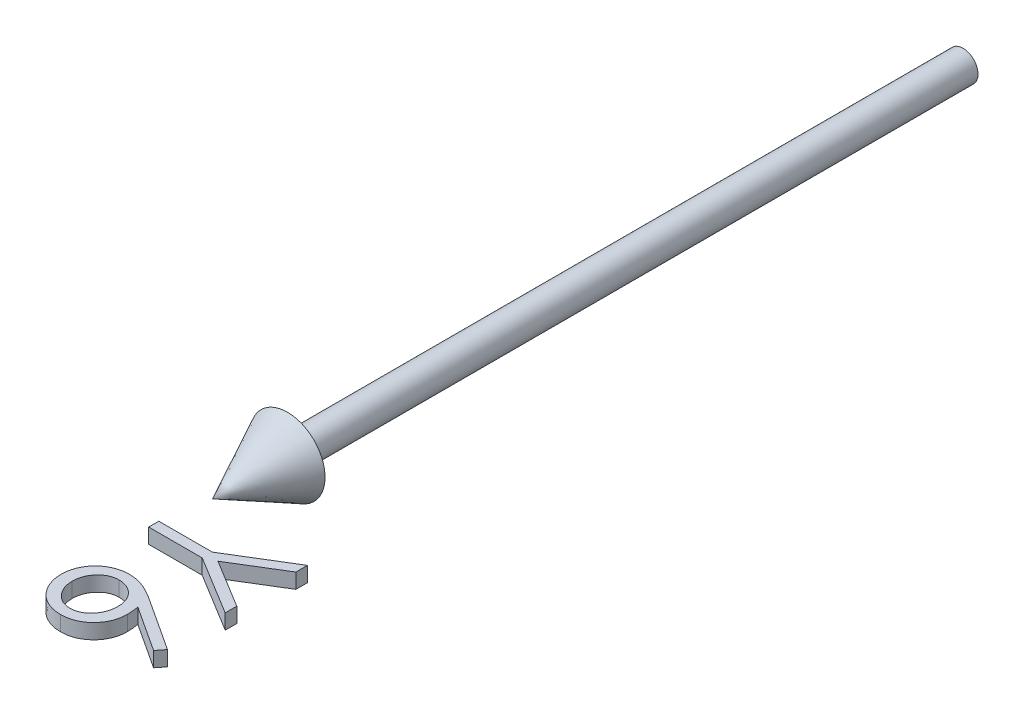
from build123d import *

# Parameters (mm, degrees)
BOSS_EXTRUDE1_DEPTH        = 1
BOSS_EXTRUDE1_DEPTH_BACK   = 1
BOSS_EXTRUDE1_2_DEPTH      = 1
BOSS_EXTRUDE1_2_DEPTH_BACK = 1


with BuildPart() as part:
    # Sketch2 → Revolve1 (revolve)
    with BuildSketch(Plane(origin=(0, 0, 0), x_dir=(1, 0, 0), z_dir=(0, 1, 0))):
        Polygon((0, -100), (5, -90), (2, -90), (2, 0), (0, 0), align=None)
    revolve(axis=Axis((0, 0, -41.949952025), (0, 0, 1)))


with BuildPart() as body_2:
    # Sketch3 → Boss-Extrude1 (new, two sides: drawn at the far end of the back side and taken through both)
    with BuildSketch(Plane(origin=(0, 0, 0), x_dir=(1, 0, 0), z_dir=(0, 1, 0)).offset(-BOSS_EXTRUDE1_DEPTH_BACK)):
        Polygon((15, -102.339799406), (15, -103.881265752), (8.5546875, -107.823573444), (15, -111.759871521), (15, -113.301337867), (7.130408654, -108.49364556), (0, -108.49364556), (0, -107.147491713), (7.130408654, -107.147491713), align=None)
    extrude(amount=BOSS_EXTRUDE1_DEPTH + BOSS_EXTRUDE1_DEPTH_BACK)


with BuildPart() as body_3:
    # Sketch3 → Boss-Extrude1 2 (new, two sides: drawn at the far end of the back side and taken through both)
    with BuildSketch(Plane(origin=(0, 0, 0), x_dir=(1, 0, 0), z_dir=(0, 1, 0)).offset(-BOSS_EXTRUDE1_2_DEPTH_BACK)):
        with BuildLine():
            Line((15.384615385, -121.378260944), (14.5703125, -122.414919598))
            Line((14.5703125, -122.414919598), (8.509615385, -118.451578252))
            add(Edge.make_bspline(
                [(8.509615385, -118.451578252), (8.551674787, -118.715450868), (8.633716408, -119.230164239), (8.64725046, -119.751160947), (8.653846154, -120.005063829)],
                knots=[0, 0, 0, 0, 1.025318673, 2, 2, 2, 2], degree=3))
            add(Edge.make_bspline(
                [(8.653846154, -120.005063829), (8.649748532, -120.157517385), (8.641682486, -120.457617672), (8.57960884, -120.898218253), (8.481786932, -121.321599407), (8.33919155, -121.726006317), (8.157038602, -122.112890525), (7.938729158, -122.484472222), (7.672990528, -122.833766551), (7.376140718, -123.165271605), (7.047353641, -123.46624488), (6.69849077, -123.732713689), (6.329915565, -123.956542797), (5.941814711, -124.138145318), (5.534786456, -124.279166226), (5.109351573, -124.381970419), (4.665216695, -124.442740103), (4.363167372, -124.450992206), (4.209735577, -124.455184021)],
                knots=[0, 0, 0, 0, 1.04369286, 2.054478336, 3.041073146, 4.015093852, 4.984733326, 5.965804835, 6.960378782, 7.985147595, 9.009457201, 10.008161701, 10.986880575, 11.956520048, 12.937015923, 13.931873656, 14.949455224, 16, 16, 16, 16], degree=3))
            add(Edge.make_bspline(
                [(4.209735577, -124.455184021), (3.999947344, -124.447356041), (3.587377155, -124.431961511), (2.983959664, -124.319895873), (2.413710712, -124.12649562), (1.874389314, -123.867749273), (1.38168706, -123.532046234), (0.936416339, -123.134219675), (0.548297495, -122.670509024), (0.215346507, -122.151895052), (-0.049182634, -121.590593674), (-0.244754428, -121.002050819), (-0.361613545, -120.391297033), (-0.376912837, -119.976511178), (-0.384615385, -119.767684021)],
                knots=[0, 0, 0, 0, 1.031881447, 2.029301251, 3.006342947, 3.987068354, 4.962916383, 5.929513747, 6.915671209, 7.928552063, 8.953527267, 9.960179832, 10.973036711, 12, 12, 12, 12], degree=3))
            add(Edge.make_bspline(
                [(-0.384615385, -119.767684021), (-0.378065948, -119.565840979), (-0.365092661, -119.166025254), (-0.249524114, -118.577885276), (-0.062208875, -118.012755904), (0.195855766, -117.474609527), (0.5218053, -116.976062437), (0.914262334, -116.530178103), (1.364553117, -116.13850785), (1.874058975, -115.814274176), (2.418030387, -115.550022852), (2.990406475, -115.363642572), (3.579667942, -115.243109959), (3.980785131, -115.230674386), (4.182692308, -115.22441479)],
                knots=[0, 0, 0, 0, 1.011913813, 2.004424092, 2.994488568, 3.992479987, 4.990471406, 5.973328987, 6.963763268, 7.974390938, 8.994854117, 9.989689954, 10.988086187, 12, 12, 12, 12], degree=3))
            add(Edge.make_bspline(
                [(4.182692308, -115.22441479), (4.337112847, -115.229850997), (4.652269778, -115.240945754), (5.130964519, -115.307157984), (5.618852651, -115.428599303), (6.032448307, -115.560025353), (6.374980445, -115.690439667), (6.645469026, -115.81136282), (6.931113653, -115.94656964), (7.226509648, -116.105050861), (7.540097115, -116.273053745), (7.860262952, -116.469300178), (8.198700605, -116.674086347), (8.424027137, -116.824107474), (8.539663462, -116.901097483)],
                knots=[0, 0, 0, 0, 1.17367173, 2.395347028, 3.66355231, 4.98980831, 5.690886799, 6.447442954, 7.240630024, 8.091733897, 8.994365608, 9.943299771, 10.944512865, 12, 12, 12, 12], degree=3))
            Line((8.539663462, -116.901097483), (15.384615385, -121.378260944))
        make_face()
        with BuildLine():
            add(Edge.make_bspline(
                [(7.115384615, -119.722611906), (7.112005971, -119.608348727), (7.105377098, -119.384165312), (7.067937177, -119.05567075), (6.996998791, -118.745611413), (6.905238355, -118.450445919), (6.780300101, -118.173250665), (6.630338776, -117.910863679), (6.452044563, -117.665888599), (6.2474054, -117.442627614), (6.026627857, -117.23761889), (5.788738619, -117.061277909), (5.54100562, -116.909000298), (5.281100468, -116.785231291), (5.009189883, -116.688842508), (4.726506574, -116.619122178), (4.431159767, -116.580320186), (4.230877582, -116.573864936), (4.128605769, -116.570568637)],
                knots=[0, 0, 0, 0, 1.129474985, 2.216020618, 3.260639938, 4.268601163, 5.26556745, 6.258792394, 7.250684778, 8.252748164, 9.247500881, 10.223461414, 11.174097059, 12.117127289, 13.062595836, 14.020469732, 14.98917545, 16, 16, 16, 16], degree=3))
            add(Edge.make_bspline(
                [(4.128605769, -116.570568637), (4.027252571, -116.57325996), (3.828514037, -116.578537244), (3.535576783, -116.626234196), (3.25393368, -116.699611913), (2.983378733, -116.807017447), (2.725387777, -116.941735391), (2.478128225, -117.107520677), (2.241429415, -117.301566158), (2.021260049, -117.527140179), (1.819315357, -117.770399891), (1.639503424, -118.027663149), (1.488509482, -118.298111956), (1.369136869, -118.583289518), (1.271367854, -118.879203126), (1.202519363, -119.188110206), (1.163606496, -119.510282178), (1.157142303, -119.728518698), (1.153846154, -119.839799406)],
                knots=[0, 0, 0, 0, 0.989642335, 1.94054129, 2.892446913, 3.828371744, 4.778262963, 5.730973156, 6.732161388, 7.763274768, 8.805796303, 9.818398792, 10.825975928, 11.825728216, 12.834635236, 13.867465554, 14.912602056, 16, 16, 16, 16], degree=3))
            add(Edge.make_bspline(
                [(1.153846154, -119.839799406), (1.157142044, -119.951080296), (1.163605731, -120.169317173), (1.202522271, -120.491486554), (1.271357182, -120.800403214), (1.369175554, -121.096282003), (1.488365973, -121.381588097), (1.640449573, -121.65227364), (1.818222088, -121.911993079), (2.02160762, -122.155093206), (2.240185355, -122.381610064), (2.48027137, -122.571110574), (2.723422593, -122.742133392), (2.984406813, -122.871677199), (3.253770808, -122.980278895), (3.535620416, -123.053286391), (3.828502614, -123.101082047), (4.027248713, -123.106345769), (4.128605769, -123.109030175)],
                knots=[0, 0, 0, 0, 1.087205562, 2.132157158, 3.164804748, 4.173533273, 5.173108684, 6.180507559, 7.20098426, 8.243321352, 9.274252308, 10.269075238, 11.227079059, 12.172305571, 13.108064818, 14.05980203, 15.010532752, 16, 16, 16, 16], degree=3))
            add(Edge.make_bspline(
                [(4.128605769, -123.109030175), (4.231022874, -123.106699265), (4.432034342, -123.102124445), (4.726240478, -123.049378695), (5.011488565, -122.97813678), (5.281352931, -122.863003317), (5.543296409, -122.725869964), (5.78983246, -122.551171082), (6.027945494, -122.350874536), (6.248869632, -122.118911701), (6.450944828, -121.866556903), (6.629310054, -121.598195965), (6.7798468, -121.317449725), (6.905448365, -121.02458938), (6.99608905, -120.716262901), (7.06746007, -120.397447117), (7.105440152, -120.064064661), (7.112027573, -119.837879195), (7.115384615, -119.722611906)],
                knots=[0, 0, 0, 0, 0.978265087, 1.920016216, 2.851775529, 3.783928695, 4.718195979, 5.674835085, 6.667117013, 7.690134047, 8.732874136, 9.755756613, 10.767227014, 11.776017537, 12.797239016, 13.836276431, 14.897336092, 16, 16, 16, 16], degree=3))
        make_face(mode=Mode.SUBTRACT)
    extrude(amount=BOSS_EXTRUDE1_2_DEPTH + BOSS_EXTRUDE1_2_DEPTH_BACK)


solid = Compound([part.part, body_2.part, body_3.part])
